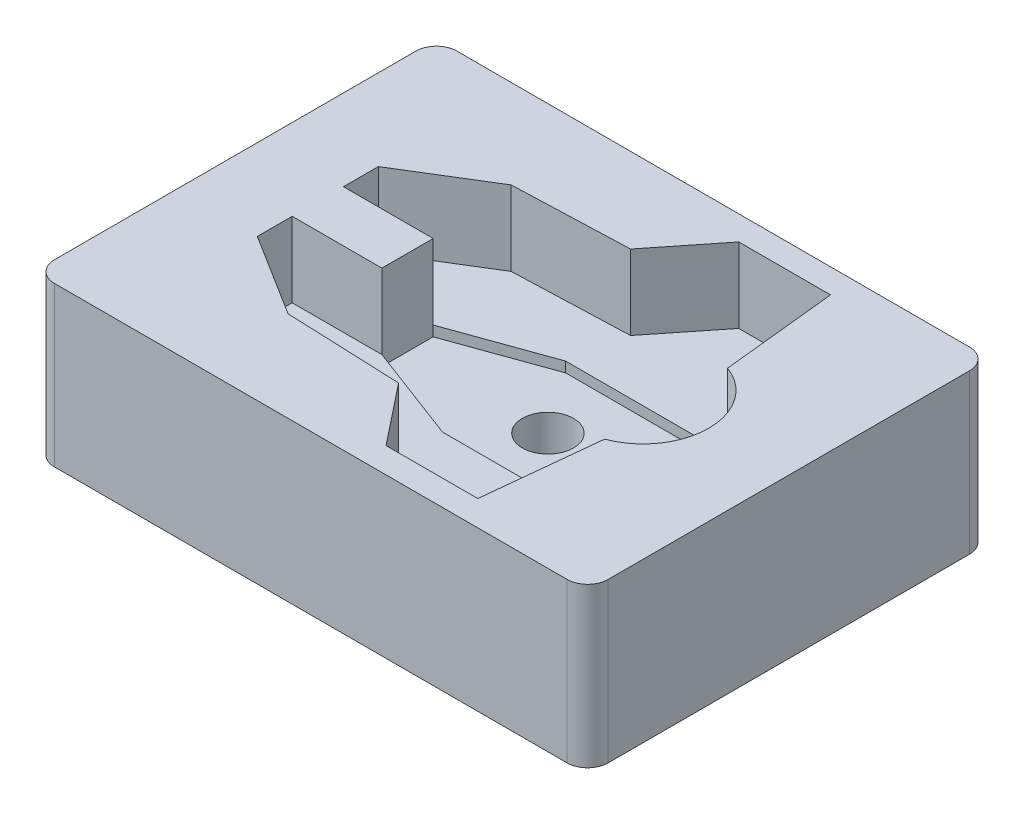
from build123d import *

# Parameters (mm, degrees)
SKETCH1_W              = 54
SKETCH1_H              = 39.25
BOSS_EXTRUDE1_DEPTH    = 15.5
FILLET1_R              = 2
FILLET2_R              = 2
M3_A_START             = -2.329776532
M3_A_BLANK_DEPTH       = 8
M3_A_START_2           = -3.329776532
M3_A_BLANK_2_DEPTH     = 1
M3_A_START_3           = -9.329776532
M3_A_BLANK_3_OUTLINE_R = 2.5
M3_A_BLANK_3_DEPTH     = 6
BODY_MOVE_COPY6_ANGLE  = 90
CUT_EXTRUDE1_DEPTH     = 13.5
SKETCH4_R              = 4.500854338
CUT_EXTRUDE3_DEPTH     = 5
CUT_EXTRUDE4_DEPTH     = 1


with BuildPart() as part:
    # Sketch1 → Boss-Extrude1 (new body)
    with BuildSketch(Plane(origin=(0, 0, 0), x_dir=(1, 0, 0), z_dir=(0, 1, 0))):
        with Locations((27, 19.625)):
            Rectangle(SKETCH1_W, SKETCH1_H)
    extrude(amount=BOSS_EXTRUDE1_DEPTH)

    # Fillet1
    fillet1_edges = [part.edges().sort_by_distance(p)[0] for p in [
        (0, 7.75, 0),
    ]]
    fillet(fillet1_edges, radius=FILLET1_R)

    # Fillet2
    fillet2_edges = [part.edges().sort_by_distance(p)[0] for p in [
        (0, 7.75, -39.25),
        (54, 7.75, -39.25),
        (54, 7.75, 0),
    ]]
    fillet(fillet2_edges, radius=FILLET2_R)


with BuildPart() as body_2:
    # M3-A Blank: read off the stored shape, not the designer's step
    # M3-A Blank outline → M3-A Blank (new body)
    with BuildSketch(Plane(origin=(0, 0, 0), x_dir=(1, 0, 0), z_dir=(0, 1, 0)).offset(M3_A_START)):
        with BuildLine():
            Line((-21.79493826, 68.00205199), (-26.79493826, 68.00205199))
            Line((-26.79493826, 68.00205199), (-26.79493826, 76.75205199))
            Line((-26.79493826, 76.75205199), (-30.19493826, 76.75205199))
            Line((-30.19493826, 76.75205199), (-35.227586031, 68.720149487))
            Line((-35.227586031, 68.720149487), (-35.685099465, 57.485652948))
            Line((-35.685099465, 57.485652948), (-41.581939277, 52.808848959))
            Line((-41.581939277, 52.808848959), (-41.581939277, 43.861919588))
            Line((-41.581939277, 43.861919588), (-30.381939277, 42.692718591))
            ThreePointArc((-30.381939277, 42.692718591), (-24.381939277, 38.532817401), (-18.381939277, 42.692718591))
            Line((-18.381939277, 42.692718591), (-7.181939277, 43.861919588))
            Line((-7.181939277, 43.861919588), (-7.181939277, 52.808848959))
            Line((-7.181939277, 52.808848959), (-13.057281533, 57.485652948))
            Line((-13.057281533, 57.485652948), (-13.463960141, 68.720149487))
            Line((-13.463960141, 68.720149487), (-18.39493826, 76.75205199))
            Line((-18.39493826, 76.75205199), (-21.79493826, 76.75205199))
            Line((-21.79493826, 76.75205199), (-21.79493826, 68.00205199))
        make_face()
    extrude(amount=M3_A_BLANK_DEPTH)

    # M3-A Blank 2 outline → M3-A Blank 2 (add)
    with BuildSketch(Plane(origin=(0, 0, 0), x_dir=(1, 0, 0), z_dir=(0, 1, 0)).offset(M3_A_START_2)):
        with BuildLine():
            Line((-30.381939277, 58.496246856), (-30.381939277, 42.692718591))
            ThreePointArc((-30.381939277, 42.692718591), (-24.381939277, 38.532817401), (-18.381939277, 42.692718591))
            Line((-18.381939277, 42.692718591), (-18.381939277, 58.496246856))
            Line((-18.381939277, 58.496246856), (-21.79493826, 68.00205199))
            Line((-21.79493826, 68.00205199), (-26.79493826, 68.00205199))
            Line((-26.79493826, 68.00205199), (-30.381939277, 58.496246856))
        make_face()
    extrude(amount=M3_A_BLANK_2_DEPTH)

    # M3-A Blank 3 outline → M3-A Blank 3 (add)
    with BuildSketch(Plane(origin=(0, 0, 0), x_dir=(1, 0, 0), z_dir=(0, 1, 0)).offset(M3_A_START_3)):
        with Locations((-24.335480832, 54.269355582)):
            Circle(M3_A_BLANK_3_OUTLINE_R)
    extrude(amount=M3_A_BLANK_3_DEPTH)


with BuildPart() as body_2_1:
    # Body-Move/Copy4: moved
    add(body_2.part.moved(Location((42.5, 8.919688157, 37.96700657))))


with BuildPart() as body_2_2:
    # Body-Move/Copy5: moved
    add(body_2_1.part.moved(Location((8.915108254, 0, 0))))


with BuildPart() as body_2_3:
    # Body-Move/Copy6: moved
    add(body_2_2.part.rotate(Axis((27.033168977, 0, -19.675428126), (0, 1, 0)), BODY_MOVE_COPY6_ANGLE))


with BuildPart() as body_2_4:
    # Body-Move/Copy7: moved
    add(body_2_3.part.moved(Location((0, 1.103676274, 0))))


with BuildPart() as body_2_5:
    # Body-Move/Copy8: moved
    add(body_2_4.part.moved(Location((0, 0.5, 0))))


with BuildPart() as part_1:
    add(part.part)

    # Intersect1: read off the stored shape, not the designer's step
    # Intersect1: cut body 2
    add(body_2_5.part, mode=Mode.SUBTRACT)

    # Sketch3 → Cut-Extrude1 (cut)
    with BuildSketch(Plane(origin=(0, 0, 0), x_dir=(-1, 0, 0), z_dir=(0, -1, 0))):
        Polygon((-5.923551682, 12.755419679), (-16.048628272, 6.41122612), (-26.192603819, 6.41122612), (-29.691162465, 2), (-2, 2), (-2, 14.017695962), (-5.923551682, 14.017695962), align=None)
        Polygon((-2, 37.25), (-29.60864948, 37.25), (-26.198159594, 32.965493874), (-15.357384062, 32.57306761), (-5.923551682, 26.781411023), (-5.923551682, 25.507817982), (-2, 25.507817982), align=None)
        Polygon((-5.923551682, 20.262429143), (-14.673551682, 20.262429143), (-14.673551682, 19.262429143), (-5.923551682, 19.262429143), (-5.923551682, 16.008924411), (-2, 16.008924411), (-2, 23.521920083), (-5.923551682, 23.521920083), align=None)
        with BuildLine():
            Line((-42.774921098, 2), (-52, 2))
            Line((-52, 2), (-52, 18.627764364))
            Line((-52, 18.627764364), (-48.077251764, 18.627764364))
            ThreePointArc((-48.077251764, 18.627764364), (-46.712904885, 14.985289801), (-43.85505184, 12.346778986))
            Line((-43.85505184, 12.346778986), (-42.774921098, 2))
        make_face()
        with BuildLine():
            Line((-52, 37.25), (-42.78544978, 37.25))
            Line((-42.78544978, 37.25), (-43.85505184, 27.004077266))
            ThreePointArc((-43.85505184, 27.004077266), (-46.741831066, 24.322246322), (-48.089593706, 20.619646239))
            Line((-48.089593706, 20.619646239), (-52, 20.619646239))
            Line((-52, 20.619646239), (-52, 37.25))
        make_face()
    extrude(amount=-CUT_EXTRUDE1_DEPTH, mode=Mode.SUBTRACT)

    # Sketch4 → Cut-Extrude3 (cut)
    with BuildSketch(Plane.XZ):
        with BuildLine():
            Line((5.923551682, -14.017695962), (5.923551682, -12.755419679))
            Line((5.923551682, -12.755419679), (16.048628272, -6.41122612))
            Line((16.048628272, -6.41122612), (26.192603819, -6.41122612))
            Line((26.192603819, -6.41122612), (29.691162465, -2))
            Line((29.691162465, -2), (42.774921098, -2))
            Line((42.774921098, -2), (43.85505184, -12.346778986))
            ThreePointArc((43.85505184, -12.346778986), (48.142786272, -19.675428126), (43.85505184, -27.004077266))
            Line((43.85505184, -27.004077266), (42.78544978, -37.25))
            Line((42.78544978, -37.25), (29.60864948, -37.25))
            Line((29.60864948, -37.25), (26.198159594, -32.965493874))
            Line((26.198159594, -32.965493874), (15.357384062, -32.57306761))
            Line((15.357384062, -32.57306761), (5.923551682, -26.781411023))
            Line((5.923551682, -26.781411023), (5.923551682, -25.507817982))
            Line((5.923551682, -25.507817982), (5.923551682, -23.521920083))
            Line((5.923551682, -23.521920083), (5.923551682, -20.262429143))
            Line((5.923551682, -20.262429143), (5.923551682, -19.262429143))
            Line((5.923551682, -19.262429143), (5.923551682, -16.008924411))
            Line((5.923551682, -16.008924411), (5.923551682, -14.017695962))
        make_face()
        with Locations(Location((30.40624809, -19.721886571, 0), (0, 0, 270))):
            Circle(SKETCH4_R, mode=Mode.SUBTRACT)
    extrude(amount=-CUT_EXTRUDE3_DEPTH, mode=Mode.SUBTRACT)

    # Sketch5 → Cut-Extrude4 (cut)
    with BuildSketch(Plane.XZ.offset(-5)):
        Polygon((43.85505184, -12.346778986), (42.774921098, -2), (29.691162465, -2), (26.192603819, -6.41122612), (16.048628272, -6.41122612), (5.923551682, -12.755419679), (5.923551682, -19.262429143), (14.673551682, -19.262429143), (14.673551682, -17.262429143), (24.035435238, -12.346778986), align=None)
        Polygon((14.673551682, -20.262429143), (5.923551682, -20.262429143), (5.923551682, -26.781411023), (15.357384062, -32.57306761), (26.198159594, -32.965493874), (29.60864948, -37.25), (42.78544978, -37.25), (43.85505184, -27.004077266), (23.961363008, -27.004077266), (14.673551682, -22.262429143), align=None)
    extrude(amount=-CUT_EXTRUDE4_DEPTH, mode=Mode.SUBTRACT)


solid = part_1.part
